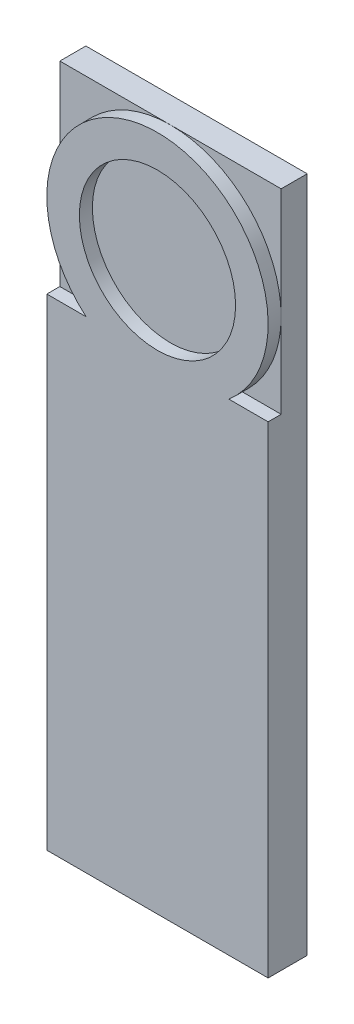
from build123d import *

# Parameters (mm, degrees)
SKETCH1_R           = 17
SKETCH1_R_2         = 12
BOSS_EXTRUDE1_DEPTH = 4
SKETCH2_W           = 34
SKETCH2_H           = 34
BOSS_EXTRUDE3_DEPTH = 4
BOSS_EXTRUDE6_DEPTH = 4
SKETCH5_W           = 34
SKETCH5_H           = 8
BOSS_EXTRUDE7_DEPTH = 70
CUT_EXTRUDE1_START  = -2
SKETCH6_R           = 12
CUT_EXTRUDE1_DEPTH  = 2


with BuildPart() as part:
    # Sketch1 → Boss-Extrude1 (new body)
    with BuildSketch(Plane.XY):
        Circle(SKETCH1_R)
        Circle(SKETCH1_R_2, mode=Mode.SUBTRACT)
    extrude(amount=BOSS_EXTRUDE1_DEPTH)

    # Sketch2 → Boss-Extrude3 (add)
    with BuildSketch(Plane(origin=(0, 0, 0), x_dir=(-1, 0, 0), z_dir=(0, 0, -1))):
        Rectangle(SKETCH2_W, SKETCH2_H)
    extrude(amount=BOSS_EXTRUDE3_DEPTH)

    # Sketch4 → Boss-Extrude6 (add)
    with BuildSketch(Plane.XZ.offset(17)):
        Polygon((-17, 4), (-17, 0), (0, 0), (17, 0), (17, 4), align=None)
    extrude(amount=-BOSS_EXTRUDE6_DEPTH)

    # Sketch5 → Boss-Extrude7 (add)
    with BuildSketch(Plane.XZ.offset(17)):
        Rectangle(SKETCH5_W, SKETCH5_H)
    extrude(amount=BOSS_EXTRUDE7_DEPTH)

    # Sketch6 → Cut-Extrude1 (cut)
    with BuildSketch(Plane.XY.offset(4).offset(CUT_EXTRUDE1_START)):
        with BuildLine():
            Line((-10.95445115, -13), (-17, -13))
            Line((-17, -13), (-17, -87))
            Line((-17, -87), (17, -87))
            Line((17, -87), (17, -13))
            Line((17, -13), (10.95445115, -13))
            ThreePointArc((10.95445115, -13), (0, 17), (-10.95445115, -13))
        make_face()
        Circle(SKETCH6_R, mode=Mode.SUBTRACT)
    extrude(amount=CUT_EXTRUDE1_DEPTH, mode=Mode.SUBTRACT)


solid = part.part
